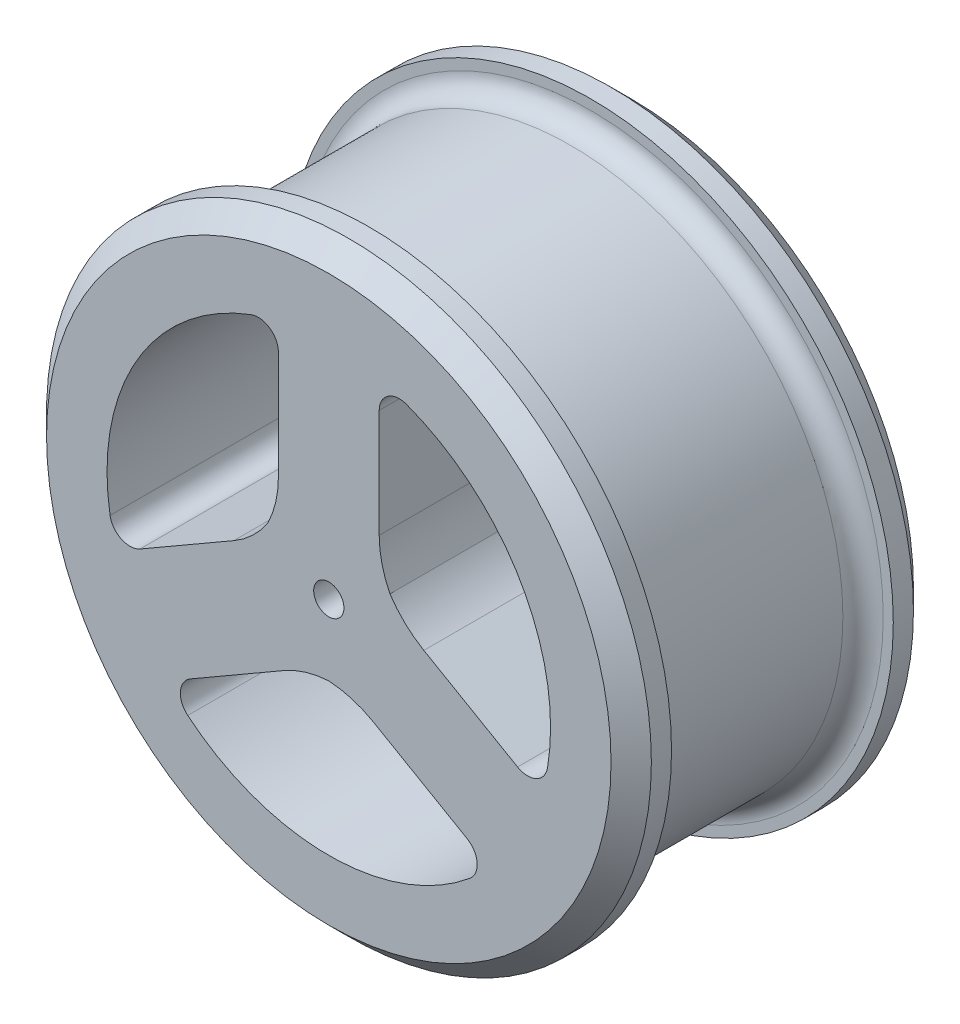
from build123d import *

# Parameters (mm, degrees)
SKETCH1_R           = 15
SKETCH1_R_2         = 0.75
BOSS_EXTRUDE1_DEPTH = 15
CUT_EXTRUDE1_START  = -11
SKETCH2_R           = 15
SKETCH2_R_2         = 13.5
CUT_EXTRUDE1_DEPTH  = 11
FILLET1_R           = 1
CUT_EXTRUDE2_DEPTH  = 26.980762114
FILLET2_R           = 5
FILLET3_R           = 1
CHAMFER2_SIZE       = 1


with BuildPart() as part:
    # Sketch1 → Boss-Extrude1 (new body)
    with BuildSketch(Plane.XY):
        Circle(SKETCH1_R)
        Circle(SKETCH1_R_2, mode=Mode.SUBTRACT)
    extrude(amount=BOSS_EXTRUDE1_DEPTH)

    # Sketch2 → Cut-Extrude1 (cut)
    with BuildSketch(Plane.XY.offset(13).offset(CUT_EXTRUDE1_START)):
        Circle(SKETCH2_R)
        Circle(SKETCH2_R_2, mode=Mode.SUBTRACT)
    extrude(amount=CUT_EXTRUDE1_DEPTH, mode=Mode.SUBTRACT)

    # Fillet1
    fillet1_edges = [part.edges().sort_by_distance(p)[0] for p in [
        (-13.5, 0, 2),
        (-13.5, 0, 13),
    ]]
    fillet(fillet1_edges, radius=FILLET1_R)

    # Sketch4 → Cut-Extrude2 (cut, through all)
    with BuildSketch(Plane.XY.offset(15)):
        with BuildLine():
            Line((2.5, 10.712142643), (2.5, 2.449489743))
            ThreePointArc((2.5, 2.449489743), (3.031088913, 1.75), (3.371320344, 0.940318638))
            Line((3.371320344, 0.940318638), (10.526987658, -3.191007812))
            ThreePointArc((10.526987658, -3.191007812), (10.881104361, -1.612937656), (11, 0))
            ThreePointArc((11, 0), (8.61684397, 6.837397166), (2.5, 10.712142643))
        make_face()
        with BuildLine():
            ThreePointArc((-8.026987658, -7.521134831), (0, -11), (8.026987658, -7.521134831))
            Line((8.026987658, -7.521134831), (0.871320344, -3.389808381))
            ThreePointArc((0.871320344, -3.389808381), (0, -3.5), (-0.871320344, -3.389808381))
            Line((-0.871320344, -3.389808381), (-8.026987658, -7.521134831))
        make_face()
        with BuildLine():
            ThreePointArc((-3.371320344, 0.940318638), (-3.031088913, 1.75), (-2.5, 2.449489743))
            Line((-2.5, 2.449489743), (-2.5, 10.712142643))
            ThreePointArc((-2.5, 10.712142643), (-9.526279442, 5.5), (-10.526987658, -3.191007812))
            Line((-10.526987658, -3.191007812), (-3.371320344, 0.940318638))
        make_face()
    extrude(amount=-CUT_EXTRUDE2_DEPTH, mode=Mode.SUBTRACT)

    # Fillet2
    # the kernel refuses this fillet: 5 mm, written as the material it adds along each edge
    with BuildSketch(Plane(origin=(-0.871320344, -3.389808381, 15), x_dir=(0.994067927349263, -0.108761003192966, 0), z_dir=(0, 0, -1)), Plane(origin=(3.371320344, 0.940318638, 15), x_dir=(-0.40284417196844124, 0.9152685797682891, 0), z_dir=(0, 0, -1)), Plane(origin=(-2.5, 2.449489743, 15), x_dir=(-0.5912237553808212, -0.8065075765753221, 0), z_dir=(0, 0, -1))) as fillet2_piece_1:
        with BuildLine():
            CenterArc((1.705620507, 4.94923638), FILLET2_R, 233.756102233, 28.072486936)
            Line((-1.25049827, 0.916698497), (0, 0))
            ThreePointArc((0, 0), (0.497472648, 0.035534534), (0.994945296, 0))
        make_face()
    extrude(amount=15)
    with BuildSketch(Plane(origin=(0.871320344, -3.389808381, 15), x_dir=(0.8660254037844362, -0.5000000000000042, 0), z_dir=(0, 0, -1)), Plane(origin=(2.5, 2.449489743, 15), x_dir=(0, 1, 0), z_dir=(0, 0, -1)), Plane(origin=(-3.371320344, 0.940318638, 15), x_dir=(-0.8660254037844451, -0.49999999999998884, 0), z_dir=(0, 0, -1))) as fillet2_piece_2:
        with BuildLine():
            CenterArc((1.550510257, 5), FILLET2_R, 241.927513064, 28.072486936)
            ThreePointArc((-0.802430919, 0.588235294), (-0.380206599, 0.322776518), (0, 0))
            Line((0, 0), (1.550510257, 0))
        make_face()
    extrude(amount=15)

    # Fillet3
    fillet3_edges = [part.edges().sort_by_distance(p)[0] for p in [
        (-2.5, 10.712142643, 7.5),
        (-10.526987658, -3.191007812, 7.5),
        (-8.026987658, -7.521134831, 7.5),
        (8.026987658, -7.521134831, 7.5),
        (10.526987658, -3.191007812, 7.5),
        (2.5, 10.712142643, 7.5),
    ]]
    fillet(fillet3_edges, radius=FILLET3_R)

    # Chamfer2
    chamfer2_edges = [part.edges().sort_by_distance(p)[0] for p in [
        (-15, 0, 0),
        (-15, 0, 15),
    ]]
    chamfer(chamfer2_edges, length=CHAMFER2_SIZE)


solid = part.part
